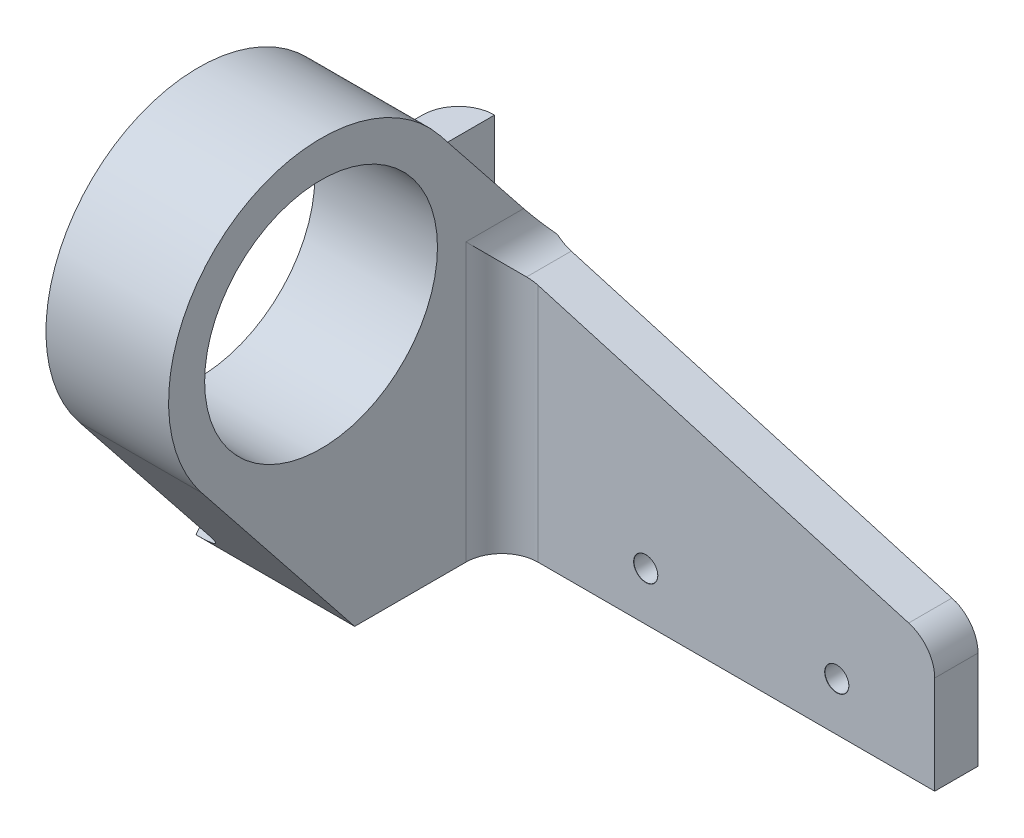
from build123d import *

# Parameters (mm, degrees)
SKETCH1_R                             = 21.14
SKETCH1_R_2                           = 16.14
BOSS_EXTRUDE1_DEPTH                   = 17
BOSS_EXTRUDE2_DEPTH                   = 17
SKETCH3_W                             = 6
SKETCH3_H                             = 34.7
BOSS_EXTRUDE3_DEPTH                   = 60
CUT_EXTRUDE1_DEPTH                    = 30
FILLET1_R                             = 5
BOSS_EXTRUDE4_DEPTH                   = 5
FILLET2_R                             = 5
TAP_DRILL_FOR_M4X0_7_TAP1_D           = 3.3
TAP_DRILL_FOR_M4X0_7_TAP1_DEPTH       = 5
TAP_DRILL_FOR_M4X0_7_TAP1_CSINK_D     = 3.35
TAP_DRILL_FOR_M4X0_7_TAP1_CSINK_ANGLE = 100
TAP_DRILL_FOR_M4X0_7_TAP1_TIP         = 0.991420021
TAP_DRILL_FOR_M4X0_7_TAP2_D           = 3.3
TAP_DRILL_FOR_M4X0_7_TAP2_DEPTH       = 7
TAP_DRILL_FOR_M4X0_7_TAP2_CSINK_D     = 3.35
TAP_DRILL_FOR_M4X0_7_TAP2_CSINK_ANGLE = 100
TAP_DRILL_FOR_M4X0_7_TAP2_TIP         = 0.991420021


with BuildPart() as part:
    # Sketch1 → Boss-Extrude1 (new body)
    with BuildSketch(Plane(origin=(0, 0, 0), x_dir=(0, 0, -1), z_dir=(1, 0, 0))):
        Circle(SKETCH1_R)
        Circle(SKETCH1_R_2, mode=Mode.SUBTRACT)
    extrude(amount=BOSS_EXTRUDE1_DEPTH)

    # Sketch2 → Boss-Extrude2 (add)
    with BuildSketch(Plane.ZY):
        with BuildLine():
            Line((-31.080697416, -39.798400642), (-31.080697416, -5.098400642))
            Line((-31.080697416, -5.098400642), (-16.538596663, 13.167172074))
            ThreePointArc((-16.538596663, 13.167172074), (-13.167172074, -16.538596663), (16.538596663, -13.167172074))
            Line((16.538596663, -13.167172074), (-4.663804983, -39.798400642))
            Line((-4.663804983, -39.798400642), (-31.080697416, -39.798400642))
        make_face()
    extrude(amount=-BOSS_EXTRUDE2_DEPTH)

    # Sketch3 → Boss-Extrude3 (add)
    with BuildSketch(Plane(origin=(17, 0, 0), x_dir=(0, 0, -1), z_dir=(1, 0, 0))):
        with Locations((28.080697416, -22.448400642)):
            Rectangle(SKETCH3_W, SKETCH3_H)
    extrude(amount=BOSS_EXTRUDE3_DEPTH)

    # Sketch4 → Cut-Extrude1 (cut)
    with BuildSketch(Plane.XY.offset(-25.080697416)):
        Polygon((17, -5.098400642), (77, -22.448400642), (77, -5.098400642), align=None)
    extrude(amount=-CUT_EXTRUDE1_DEPTH, mode=Mode.SUBTRACT)

    # Fillet1
    fillet1_edges = [part.edges().sort_by_distance(p)[0] for p in [
        (17, -5.098400642, -28.080697416),
        (17, -22.448400642, -25.080697416),
        (77, -22.448400642, -28.080697416),
    ]]
    fillet(fillet1_edges, radius=FILLET1_R)

    # Sketch5 → Boss-Extrude4 (add)
    with BuildSketch(Plane.ZY):
        Polygon((-31.080697416, -5.098400642), (-41.06651396, -5.098400642), (-41.06651396, -39.798400642), (-25.501919328, -39.798400642), (-4.663804983, -39.798400642), align=None)
    extrude(amount=BOSS_EXTRUDE4_DEPTH)

    # Fillet2
    # the kernel refuses this fillet: 5 mm, written as the material it adds along each edge
    with BuildSketch(Plane(origin=(0, -49.744226019, 2.907889517), x_dir=(0, 0.6057355599289151, 0.795666030089009), z_dir=(0, 0.795666030089009, -0.6057355599289151))) as fillet2_piece_1_section:
        with BuildLine():
            CenterArc((FILLET2_R, -FILLET2_R), FILLET2_R, 90, 90)
            Line((0, -FILLET2_R), (0, 0))
            Line((0, 0), (FILLET2_R, 0))
        make_face()
    fillet2_piece_1 = extrude(amount=68.611262374, mode=Mode.PRIVATE)
    fillet2_piece_1 = split(fillet2_piece_1, bisect_by=Plane(origin=(-1.148121472, -8.497406794, -33.786809657), z_dir=(0, -0.6228558218455279, 0.7823366444141115)), keep=Keep.TOP, mode=Mode.PRIVATE)
    fillet2_piece_1 = split(fillet2_piece_1, bisect_by=Plane(origin=(-1.148121472, -34.831750942, -0.709616331), z_dir=(0, 0.6228558218455282, -0.7823366444141113)), keep=Keep.TOP, mode=Mode.PRIVATE)
    fillet2_piece_1 = split(fillet2_piece_1, bisect_by=Plane(origin=(-1.148121472, -39.798400642, -16.823425528), z_dir=(0, 1, 0)), keep=Keep.TOP, mode=Mode.PRIVATE)
    add(fillet2_piece_1)
    # the kernel refuses this fillet: 5 mm, written as the material it takes off along each edge
    with BuildSketch(Plane(origin=(-5, 7.401599358, -41.06651396), x_dir=(0, 0, 1), z_dir=(0, -1, 0))) as fillet2_2_piece_1:
        with BuildLine():
            CenterArc((FILLET2_R, -FILLET2_R), FILLET2_R, 90, 90)
            Line((0, -FILLET2_R), (0, 0))
            Line((0, 0), (FILLET2_R, 0))
        make_face()
    extrude(amount=59.7, mode=Mode.SUBTRACT)

    # Tap Drill for M4x0.7 Tap1
    with Locations(Plane.ZY.offset(5)):
        with Locations((-35.156261267, -14.70127854), (-35.156261267, -34.106690994)):
            CounterSinkHole(TAP_DRILL_FOR_M4X0_7_TAP1_D / 2, TAP_DRILL_FOR_M4X0_7_TAP1_CSINK_D / 2, depth=TAP_DRILL_FOR_M4X0_7_TAP1_DEPTH, counter_sink_angle=TAP_DRILL_FOR_M4X0_7_TAP1_CSINK_ANGLE)
            with Locations((0, 0, -(TAP_DRILL_FOR_M4X0_7_TAP1_DEPTH + TAP_DRILL_FOR_M4X0_7_TAP1_TIP / 2))):  # 118° drill point
                Cone(0, TAP_DRILL_FOR_M4X0_7_TAP1_D / 2, TAP_DRILL_FOR_M4X0_7_TAP1_TIP, mode=Mode.SUBTRACT)

    # Tap Drill for M4x0.7 Tap2
    with Locations(Plane.XY.offset(-25.080697416)):
        with Locations((36.93257039, -33.095127913), (63.418354043, -33.095127913)):
            CounterSinkHole(TAP_DRILL_FOR_M4X0_7_TAP2_D / 2, TAP_DRILL_FOR_M4X0_7_TAP2_CSINK_D / 2, depth=TAP_DRILL_FOR_M4X0_7_TAP2_DEPTH, counter_sink_angle=TAP_DRILL_FOR_M4X0_7_TAP2_CSINK_ANGLE)
            with Locations((0, 0, -(TAP_DRILL_FOR_M4X0_7_TAP2_DEPTH + TAP_DRILL_FOR_M4X0_7_TAP2_TIP / 2))):  # 118° drill point
                Cone(0, TAP_DRILL_FOR_M4X0_7_TAP2_D / 2, TAP_DRILL_FOR_M4X0_7_TAP2_TIP, mode=Mode.SUBTRACT)


solid = part.part
